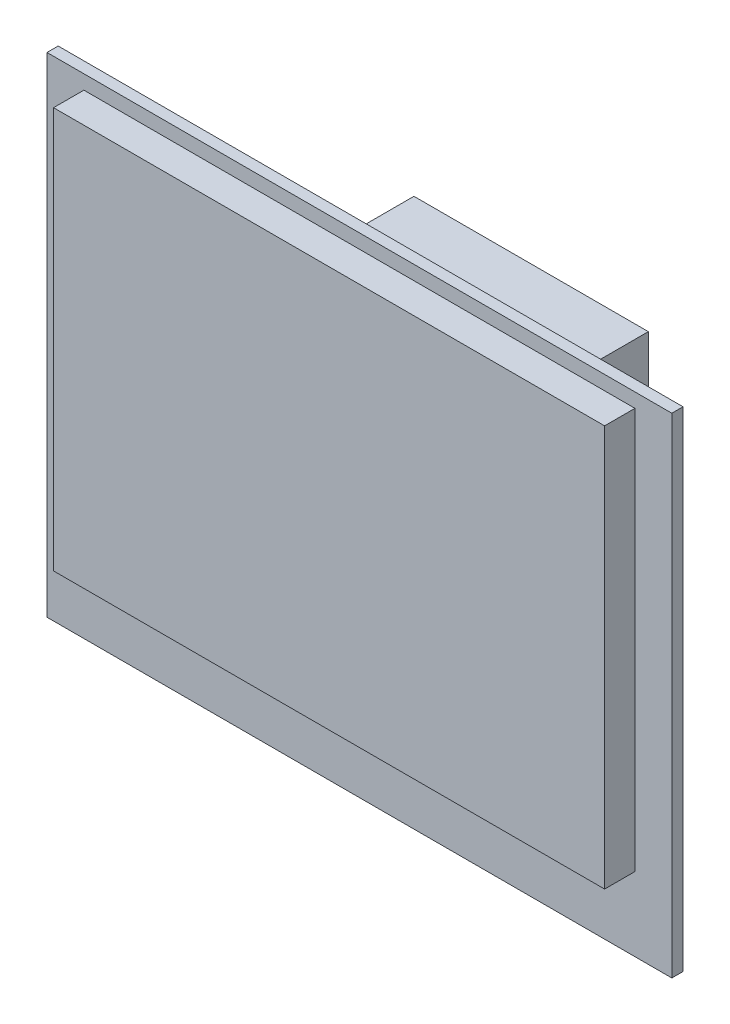
from build123d import *

# Parameters (mm, degrees)
SKETCH1_W           = 87.968173892
SKETCH1_H           = 68.8600253
BOSS_EXTRUDE1_DEPTH = 1.5748
SKETCH2_W           = 77.58
SKETCH2_H           = 56.48
BOSS_EXTRUDE2_DEPTH = 4.27
SKETCH3_W           = 33
SKETCH3_H           = 8.96
BOSS_EXTRUDE3_DEPTH = 8.87
SKETCH4_W           = 8.525
SKETCH4_H           = 5.225
BOSS_EXTRUDE4_DEPTH = 4


with BuildPart() as part:
    # Sketch1 → Boss-Extrude1 (new body)
    with BuildSketch(Plane.XY):
        Rectangle(SKETCH1_W, SKETCH1_H)
    extrude(amount=BOSS_EXTRUDE1_DEPTH)

    # Sketch2 → Boss-Extrude2 (add)
    with BuildSketch(Plane.XY.offset(1.5748)):
        with Locations((0, 4.19001265)):
            Rectangle(SKETCH2_W, SKETCH2_H)
    extrude(amount=BOSS_EXTRUDE2_DEPTH)

    # Sketch3 → Boss-Extrude3 (add)
    with BuildSketch(Plane(origin=(0, 0, 0), x_dir=(-1, 0, 0), z_dir=(0, 0, -1))):
        with Locations((-13.734086946, 27.80001265)):
            Rectangle(SKETCH3_W, SKETCH3_H)
    extrude(amount=BOSS_EXTRUDE3_DEPTH)

    # Sketch4 → Boss-Extrude4 (add)
    with BuildSketch(Plane(origin=(0, 0, 0), x_dir=(-1, 0, 0), z_dir=(0, 0, -1))):
        with Locations((9.808413054, 27.39251265)):
            Rectangle(SKETCH4_W, SKETCH4_H)
    extrude(amount=BOSS_EXTRUDE4_DEPTH)


solid = part.part
